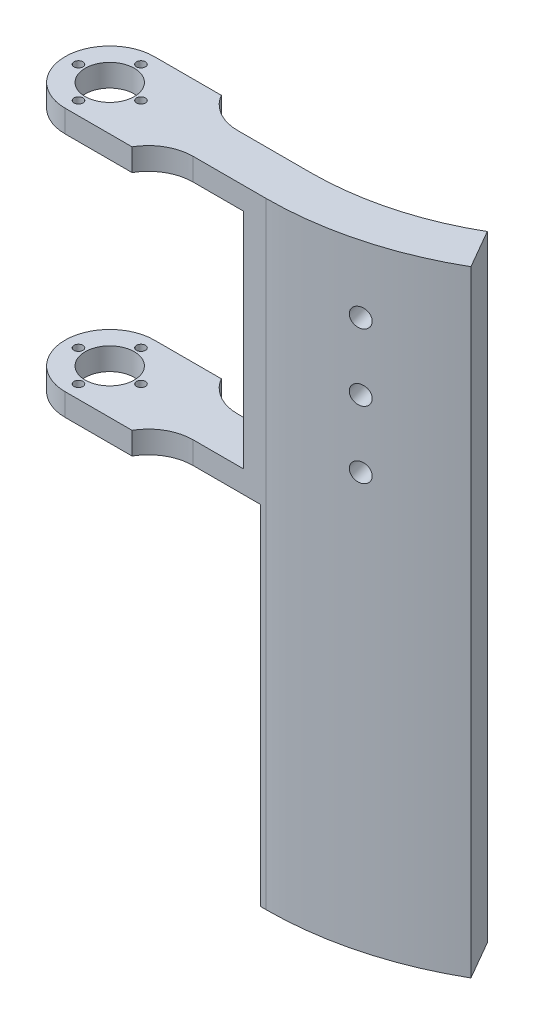
from build123d import *

# Parameters (mm, degrees)
BOSS_EXTRUDE2_DEPTH = 20
FILLET1_RADIUS      = 10
FILLET1_LENGTH      = 5
FILLET2_RADIUS      = 10
FILLET2_LENGTH      = 5
SKETCH5_R           = 1
SKETCH5_R_2         = 5.5
CUT_EXTRUDE5_DEPTH  = 69.007352544
CUT_EXTRUDE7_DEPTH  = 25
FILLET5_R           = 10
BOSS_EXTRUDE5_DEPTH = 60
SKETCH13_R          = 2.1
CUT_EXTRUDE8_DEPTH  = 60
BOSS_EXTRUDE6_START = 78
BOSS_EXTRUDE6_DEPTH = 78


with BuildPart() as part:
    # Sketch1 → Boss-Extrude2 (new body)
    with BuildSketch(Plane.XY):
        Polygon((-25, 30), (25, 30), (25, -30), (-25, -30), (-25, -25), (-20, -25), (20, -25), (20, 25), (-20, 25), (-25, 25), align=None)
    extrude(amount=BOSS_EXTRUDE2_DEPTH)

    # Fillet1: full round fillet: the end face becomes a half cylinder, R = half its width
    fillet1_face = Plane((-25, 27.5, 10), x_dir=(0, -1, 0), z_dir=(-1, 0, 0))  # on the end face: x along it, z out of the body
    fillet1_slab = fillet1_face.offset(-FILLET1_RADIUS / 2) * Box(FILLET1_LENGTH, 2 * FILLET1_RADIUS, FILLET1_RADIUS, mode=Mode.PRIVATE)  # the body's end, R deep
    fillet1_round = Plane((-15, 27.5, 10), x_dir=(-1, 0, 0), z_dir=(0, -1, 0)) * Cylinder(FILLET1_RADIUS, FILLET1_LENGTH, mode=Mode.PRIVATE)  # its axis R under the face
    add(fillet1_slab - fillet1_round, mode=Mode.SUBTRACT)

    # Fillet2: full round fillet: the end face becomes a half cylinder, R = half its width
    fillet2_face = Plane((-25, -27.5, 10), x_dir=(0, -1, 0), z_dir=(-1, 0, 0))  # on the end face: x along it, z out of the body
    fillet2_slab = fillet2_face.offset(-FILLET2_RADIUS / 2) * Box(FILLET2_LENGTH, 2 * FILLET2_RADIUS, FILLET2_RADIUS, mode=Mode.PRIVATE)  # the body's end, R deep
    fillet2_round = Plane((-15, -27.5, 10), x_dir=(-1, 0, 0), z_dir=(0, -1, 0)) * Cylinder(FILLET2_RADIUS, FILLET2_LENGTH, mode=Mode.PRIVATE)  # its axis R under the face
    add(fillet2_slab - fillet2_round, mode=Mode.SUBTRACT)

    # Sketch5 → Cut-Extrude5 (cut, through all)
    with BuildSketch(Plane(origin=(0, 30, 0), x_dir=(1, 0, 0), z_dir=(0, 1, 0))):
        with Locations(Location((-15, -3, 0), (0, 0, 180))):
            Circle(SKETCH5_R)
        with Locations(Location((-22, -10, 0), (0, 0, 180))):
            Circle(SKETCH5_R)
        with Locations(Location((-15, -17, 0), (0, 0, 180))):
            Circle(SKETCH5_R)
        with Locations(Location((-8, -10, 0), (0, 0, 180))):
            Circle(SKETCH5_R)
        with Locations(Location((-15, -10, 0), (0, 0, 180))):
            Circle(SKETCH5_R_2)
    extrude(amount=-CUT_EXTRUDE5_DEPTH, mode=Mode.SUBTRACT)

    # Sketch10 → Cut-Extrude7 (cut)
    with BuildSketch(Plane(origin=(25, 0, 0), x_dir=(0, 0, -1), z_dir=(1, 0, 0))):
        Polygon((-15, 28.180148829), (-15, -28.180148829), (-15, -30), (-20, -30), (-20, 30), (-15, 30), align=None)
        Polygon((-5, 28.180148829), (-5, -28.180148829), (-5, -30), (0, -30), (0, 30), (-5, 30), align=None)
    extrude(amount=-CUT_EXTRUDE7_DEPTH, mode=Mode.SUBTRACT)

    # Fillet5
    # the kernel refuses this fillet: 10 mm, written as the material it adds along each edge
    with BuildSketch(Plane(origin=(0, 25, 15), x_dir=(1, 0, 0), z_dir=(0, 1, 0)), Plane(origin=(0, -30, 15), x_dir=(1, 0, 0), z_dir=(0, 1, 0)), Plane(origin=(0, -25, 5), x_dir=(1, 0, 0), z_dir=(0, -1, 0))) as fillet5_piece_1:
        with BuildLine():
            CenterArc((8.660254038, -10), FILLET5_R, 90, 60)
            Line((0, -5), (-0.173205081, -4.9))
            ThreePointArc((-0.173205081, -4.9), (-0.2, -2.5), (-0.2, 0))
            Line((-0.2, 0), (0, 0.2))
            Line((0, 0.2), (8.660254038, 0.2))
            Line((8.660254038, 0.2), (8.660254038, 0))
        make_face()
    extrude(amount=5)
    with BuildSketch(Plane(origin=(0, 30, 5), x_dir=(0, 0, -1), z_dir=(0, -1, 0))) as fillet5_piece_2:
        with BuildLine():
            CenterArc((10, 8.660254038), FILLET5_R, 180, 60)
            Line((0, 8.660254038), (-0.2, 8.660254038))
            Line((-0.2, 8.660254038), (-0.2, 0))
            Line((-0.2, 0), (0, -0.2))
            ThreePointArc((0, -0.2), (2.5, -0.2), (4.9, -0.173205081))
            Line((4.9, -0.173205081), (5, 0))
        make_face()
    extrude(amount=5)

    # Sketch12 → Boss-Extrude5 (add)
    with BuildSketch(Plane.XZ.offset(30)):
        with BuildLine():
            Line((56.226298398, -3.359735054), (61.222506141, 5.302707337))
            ThreePointArc((61.222506141, 5.302707337), (43.74904955, 12.533728595), (25, 15))
            Line((25, 15), (25, 5))
            ThreePointArc((25, 5), (41.16297375, 2.873903962), (56.226298398, -3.359735054))
        make_face()
    extrude(amount=-BOSS_EXTRUDE5_DEPTH)

    # Sketch13 → Cut-Extrude8 (cut)
    with BuildSketch(Plane(origin=(2.920998947, 0, 10.910870277), x_dir=(-0.9659824633840055, 0, 0.2586075800021504), z_dir=(-0.2586075800021504, 0, -0.9659824633840055))):
        with Locations((-39.019497435, 15)):
            Circle(SKETCH13_R)
        with Locations((-39.019497435, 0)):
            Circle(SKETCH13_R)
        with Locations((-39.019497435, -15)):
            Circle(SKETCH13_R)
    extrude(amount=-CUT_EXTRUDE8_DEPTH, mode=Mode.SUBTRACT)

    # Sketch14 → Boss-Extrude6 (add)
    with BuildSketch(Plane.XZ.offset(30).offset(BOSS_EXTRUDE6_START)):
        with BuildLine():
            Line((61.222506141, 5.302707337), (56.226298398, -3.359735054))
            ThreePointArc((56.226298398, -3.359735054), (41.16297375, 2.873903962), (25, 5))
            Line((25, 5), (23.767457853, 5))
            Line((23.767457853, 5), (23.767457853, 15))
            Line((23.767457853, 15), (25, 15))
            ThreePointArc((25, 15), (43.74904955, 12.533728595), (61.222506141, 5.302707337))
        make_face()
    extrude(amount=-BOSS_EXTRUDE6_DEPTH)


solid = part.part
